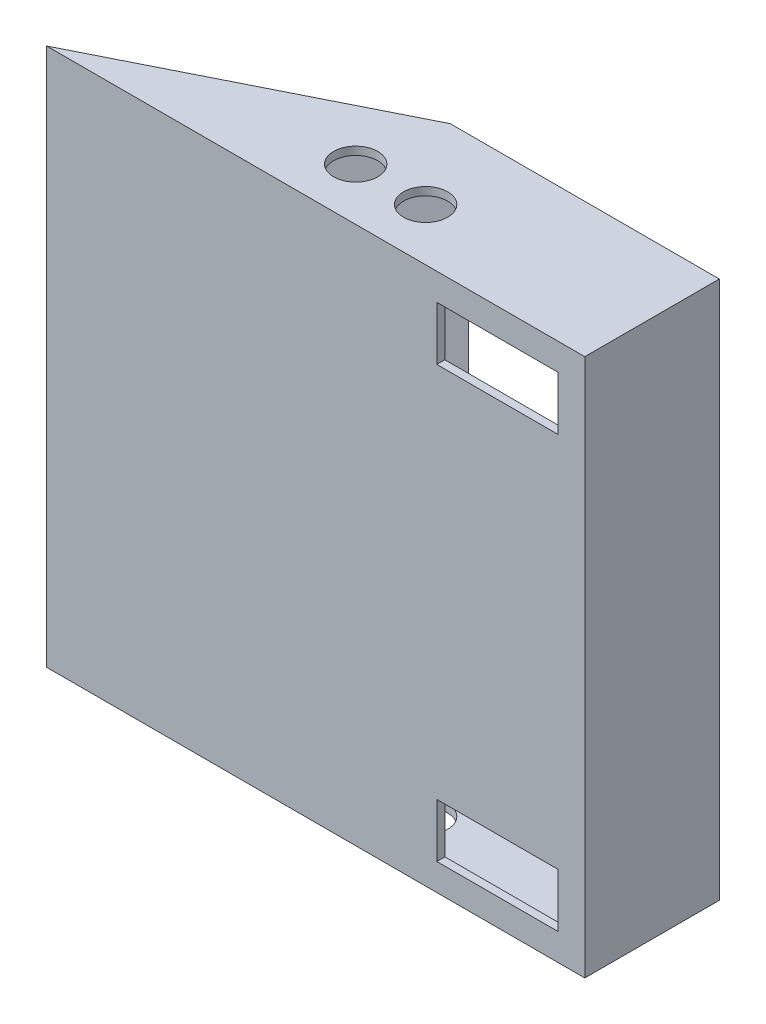
from build123d import *

# Parameters (mm, degrees)
SALIENTE_EXTRUIR1_DEPTH = 200
VACIADO2_T              = -3
CROQUIS4_R              = 8.2
CORTAR_EXTRUIR2_DEPTH   = 288.228132327
CROQUIS7_W              = 45
CROQUIS7_H              = 20
CORTAR_EXTRUIR4_DEPTH   = 287.721118859


with BuildPart() as part:
    # Croquis2 → Saliente-Extruir1 (new body)
    with BuildSketch(Plane(origin=(0, 0, 0), x_dir=(1, 0, 0), z_dir=(0, 1, 0))):
        Polygon((0, 0), (200, 0), (200, 50), (100, 50), align=None)
    extrude(amount=SALIENTE_EXTRUIR1_DEPTH)

    # Vaciado2
    vaciado2_openings = [part.faces().sort_by_distance(p)[0] for p in [
        (150, 100, -50),
    ]]
    offset(amount=VACIADO2_T, openings=vaciado2_openings, kind=Kind.INTERSECTION)

    # Croquis4 → Cortar-Extruir2 (cut, through all)
    with BuildSketch(Plane.XZ):
        with Locations((121.442806494, -19.4)):
            Circle(CROQUIS4_R)
        with Locations((95.442806494, -19.4)):
            Circle(CROQUIS4_R)
    extrude(amount=-CORTAR_EXTRUIR2_DEPTH, mode=Mode.SUBTRACT)

    # Croquis7 → Cortar-Extruir4 (cut, through all)
    with BuildSketch(Plane(origin=(0, 0, -3), x_dir=(-1, 0, 0), z_dir=(0, 0, -1))):
        with Locations((-167.5, 20)):
            Rectangle(CROQUIS7_W, CROQUIS7_H)
        with Locations((-167.5, 180)):
            Rectangle(CROQUIS7_W, CROQUIS7_H)
    extrude(amount=-CORTAR_EXTRUIR4_DEPTH, mode=Mode.SUBTRACT)


solid = part.part
